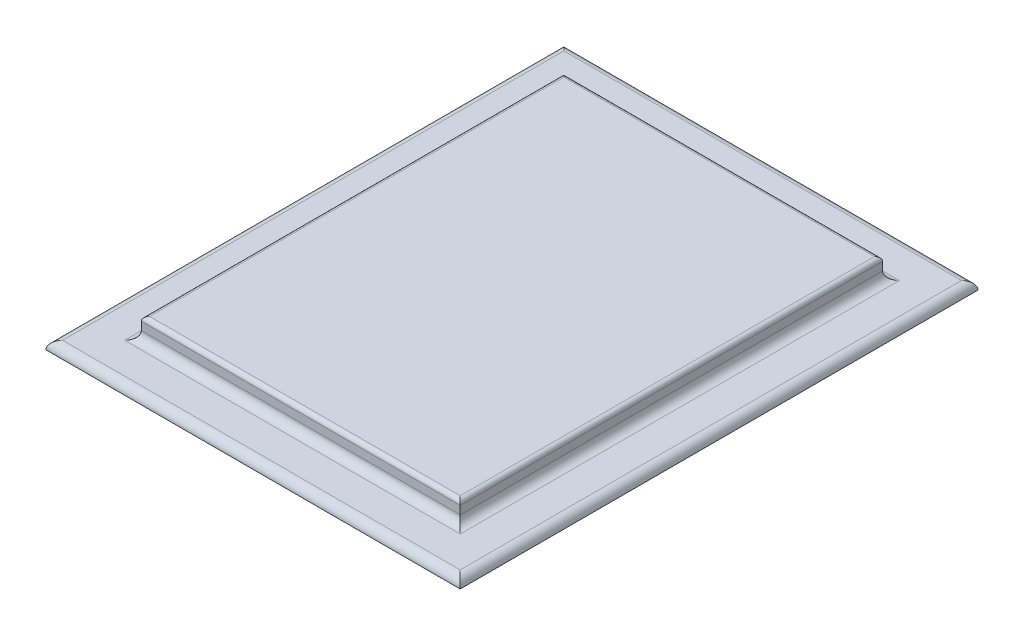
from build123d import *

# Parameters (mm, degrees)
SKETCH1_W           = 20
SKETCH1_H           = 25
BOSS_EXTRUDE1_DEPTH = 0.4
SKETCH4_W           = 15.4
SKETCH4_H           = 20.4
BOSS_EXTRUDE3_DEPTH = 1
SKETCH5_W           = 15
SKETCH5_H           = 20
CUT_EXTRUDE1_DEPTH  = 1
FILLET3_R           = 0.4
FILLET4_R           = 0.2
FILLET5_R           = 0.5
FILLET6_R           = 0.4


with BuildPart() as part:
    # Sketch1 → Boss-Extrude1 (new body)
    with BuildSketch(Plane(origin=(0, 0, 0), x_dir=(1, 0, 0), z_dir=(0, 1, 0))):
        with Locations((12.385620915, 0.612745098)):
            Rectangle(SKETCH1_W, SKETCH1_H)
    extrude(amount=BOSS_EXTRUDE1_DEPTH)

    # Sketch4 → Boss-Extrude3 (add)
    with BuildSketch(Plane(origin=(0, 0.4, 0), x_dir=(1, 0, 0), z_dir=(0, 1, 0))):
        with Locations((12.385620915, 0.612745098)):
            Rectangle(SKETCH4_W, SKETCH4_H)
    extrude(amount=BOSS_EXTRUDE3_DEPTH)

    # Sketch5 → Cut-Extrude1 (cut)
    with BuildSketch(Plane.XZ):
        with Locations((12.385620915, -0.612745098)):
            Rectangle(SKETCH5_W, SKETCH5_H)
    extrude(amount=-CUT_EXTRUDE1_DEPTH, mode=Mode.SUBTRACT)

    # Fillet3
    fillet3_edges = [part.edges().sort_by_distance(p)[0] for p in [
        (4.685620915, 0.4, -0.612745098),
        (12.385620915, 0.4, 9.587254902),
        (20.085620915, 0.4, -0.612745098),
        (12.385620915, 0.4, -10.812745098),
    ]]
    fillet(fillet3_edges, radius=FILLET3_R)

    # Fillet4
    fillet4_edges = [part.edges().sort_by_distance(p)[0] for p in [
        (4.685620915, 1.4, -0.612745098),
        (12.385620915, 1.4, 9.587254902),
        (20.085620915, 1.4, -0.612745098),
        (12.385620915, 1.4, -10.812745098),
    ]]
    fillet(fillet4_edges, radius=FILLET4_R)

    # Fillet5
    fillet5_edges = [part.edges().sort_by_distance(p)[0] for p in [
        (4.885620915, 1, -0.612745098),
        (12.385620915, 1, 9.387254902),
        (19.885620915, 1, -0.612745098),
        (12.385620915, 1, -10.612745098),
    ]]
    fillet(fillet5_edges, radius=FILLET5_R)

    # Fillet6
    fillet6_edges = [part.edges().sort_by_distance(p)[0] for p in [
        (12.385620915, 0.4, 11.887254902),
        (2.385620915, 0.4, -0.612745098),
        (22.385620915, 0.4, -0.612745098),
        (12.385620915, 0.4, -13.112745098),
    ]]
    fillet(fillet6_edges, radius=FILLET6_R - 0.0001)  # a hair under: the kernel refuses the full size


solid = part.part
